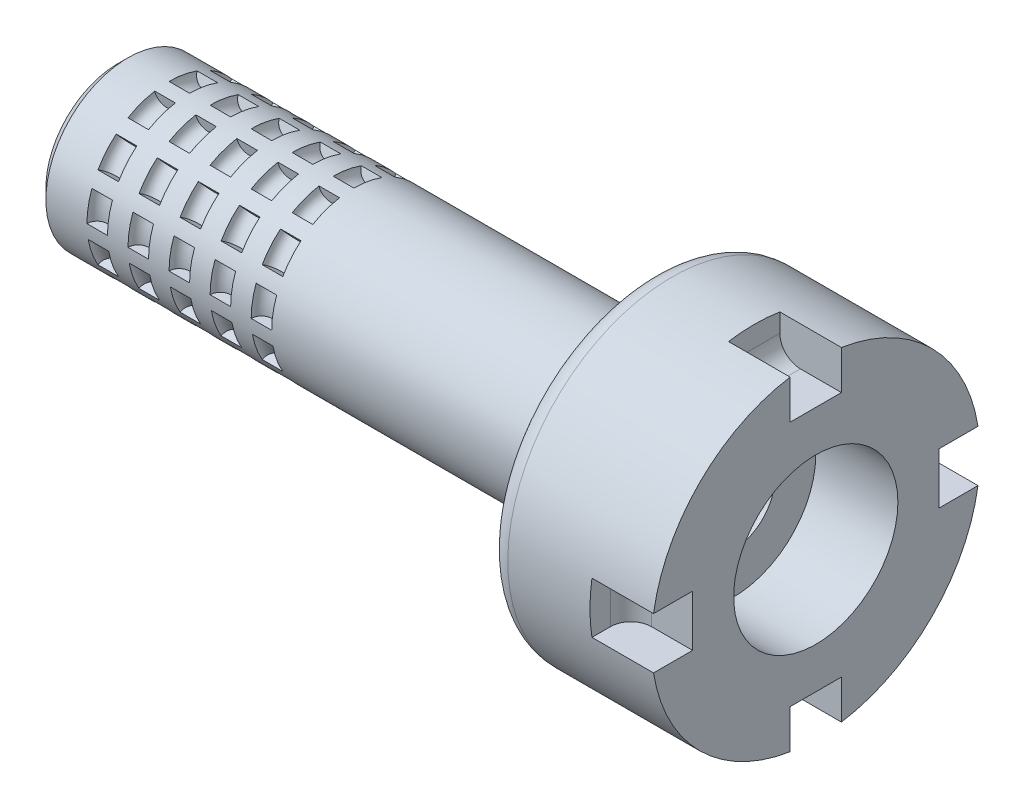
from build123d import *

# Parameters (mm, degrees)
WYTNIJ_WYCI_GNI_CIE1_START      = -40
SZKIC3_R                        = 40
WYTNIJ_WYCI_GNI_CIE1_DEPTH      = 40
SZKIC4_W                        = 25
SZKIC4_H                        = 30
WYTNIJ_WYCI_GNI_CIE2_DEPTH      = 30
ZAOKR_GLENIE1_R                 = 10
SZYK_KO_OWY2_COUNT              = 4
ZAOKR_GLENIE1_OF_SZYK_KO_OWY2_R = 10
ZAOKR_GLENIE2_R                 = 10
SFAZOWANIE1_SIZE                = 5
SZKIC6_W                        = 15
SZKIC6_H                        = 5
ZAOKR_GLENIE3_R                 = 2.5
SZKIC7_R                        = 5
WYCI_CIE_OBR_T3_ANGLE           = 20
SZYK_KO_OWY3_COUNT              = 12
SZYK_LINIOWY1_COUNT             = 5
SZYK_LINIOWY1_PITCH             = 20
SZYK_LINIOWY1_COPY_1_SKETCH_R   = 5
SZYK_LINIOWY1_COPY_1_ANGLE      = 20
SZYK_LINIOWY1_COPY_2_SKETCH_R   = 5
SZYK_LINIOWY1_COPY_2_ANGLE      = 20
SZYK_LINIOWY1_COPY_3_SKETCH_R   = 5
SZYK_LINIOWY1_COPY_3_ANGLE      = 20
SZYK_LINIOWY1_COPY_4_SKETCH_R   = 5
SZYK_LINIOWY1_COPY_4_ANGLE      = 20
SZYK_LINIOWY1_COPY_5_SKETCH_R   = 5
SZYK_LINIOWY1_COPY_5_ANGLE      = 20
SZYK_LINIOWY1_COPY_6_SKETCH_R   = 5
SZYK_LINIOWY1_COPY_6_ANGLE      = 20
SZYK_LINIOWY1_COPY_7_SKETCH_R   = 5
SZYK_LINIOWY1_COPY_7_ANGLE      = 20
SZYK_LINIOWY1_COPY_8_SKETCH_R   = 5
SZYK_LINIOWY1_COPY_8_ANGLE      = 20
SZYK_LINIOWY1_COPY_9_SKETCH_R   = 5
SZYK_LINIOWY1_COPY_9_ANGLE      = 20
SZYK_LINIOWY1_COPY_10_SKETCH_R  = 5
SZYK_LINIOWY1_COPY_10_ANGLE     = 20
SZYK_LINIOWY1_COPY_11_SKETCH_R  = 5
SZYK_LINIOWY1_COPY_11_ANGLE     = 20
SZYK_LINIOWY1_COPY_12_SKETCH_R  = 5
SZYK_LINIOWY1_COPY_12_ANGLE     = 20
SZYK_LINIOWY1_COPY_13_SKETCH_R  = 5
SZYK_LINIOWY1_COPY_13_ANGLE     = 20
SZYK_LINIOWY1_COPY_14_SKETCH_R  = 5
SZYK_LINIOWY1_COPY_14_ANGLE     = 20
SZYK_LINIOWY1_COPY_15_SKETCH_R  = 5
SZYK_LINIOWY1_COPY_15_ANGLE     = 20
SZYK_LINIOWY1_COPY_16_SKETCH_R  = 5
SZYK_LINIOWY1_COPY_16_ANGLE     = 20
SZYK_LINIOWY1_COPY_17_SKETCH_R  = 5
SZYK_LINIOWY1_COPY_17_ANGLE     = 20
SZYK_LINIOWY1_COPY_18_SKETCH_R  = 5
SZYK_LINIOWY1_COPY_18_ANGLE     = 20
SZYK_LINIOWY1_COPY_19_SKETCH_R  = 5
SZYK_LINIOWY1_COPY_19_ANGLE     = 20
SZYK_LINIOWY1_COPY_20_SKETCH_R  = 5
SZYK_LINIOWY1_COPY_20_ANGLE     = 20
SZYK_LINIOWY1_COPY_21_SKETCH_R  = 5
SZYK_LINIOWY1_COPY_21_ANGLE     = 20
SZYK_LINIOWY1_COPY_22_SKETCH_R  = 5
SZYK_LINIOWY1_COPY_22_ANGLE     = 20
SZYK_LINIOWY1_COPY_23_SKETCH_R  = 5
SZYK_LINIOWY1_COPY_23_ANGLE     = 20
SZYK_LINIOWY1_COPY_24_SKETCH_R  = 5
SZYK_LINIOWY1_COPY_24_ANGLE     = 20
SZYK_LINIOWY1_COPY_25_SKETCH_R  = 5
SZYK_LINIOWY1_COPY_25_ANGLE     = 20
SZYK_LINIOWY1_COPY_26_SKETCH_R  = 5
SZYK_LINIOWY1_COPY_26_ANGLE     = 20
SZYK_LINIOWY1_COPY_27_SKETCH_R  = 5
SZYK_LINIOWY1_COPY_27_ANGLE     = 20
SZYK_LINIOWY1_COPY_28_SKETCH_R  = 5
SZYK_LINIOWY1_COPY_28_ANGLE     = 20
SZYK_LINIOWY1_COPY_29_SKETCH_R  = 5
SZYK_LINIOWY1_COPY_29_ANGLE     = 20
SZYK_LINIOWY1_COPY_30_SKETCH_R  = 5
SZYK_LINIOWY1_COPY_30_ANGLE     = 20
SZYK_LINIOWY1_COPY_31_SKETCH_R  = 5
SZYK_LINIOWY1_COPY_31_ANGLE     = 20
SZYK_LINIOWY1_COPY_32_SKETCH_R  = 5
SZYK_LINIOWY1_COPY_32_ANGLE     = 20
SZYK_LINIOWY1_COPY_33_SKETCH_R  = 5
SZYK_LINIOWY1_COPY_33_ANGLE     = 20
SZYK_LINIOWY1_COPY_34_SKETCH_R  = 5
SZYK_LINIOWY1_COPY_34_ANGLE     = 20
SZYK_LINIOWY1_COPY_35_SKETCH_R  = 5
SZYK_LINIOWY1_COPY_35_ANGLE     = 20
SZYK_LINIOWY1_COPY_36_SKETCH_R  = 5
SZYK_LINIOWY1_COPY_36_ANGLE     = 20
SZYK_LINIOWY1_COPY_37_SKETCH_R  = 5
SZYK_LINIOWY1_COPY_37_ANGLE     = 20
SZYK_LINIOWY1_COPY_38_SKETCH_R  = 5
SZYK_LINIOWY1_COPY_38_ANGLE     = 20
SZYK_LINIOWY1_COPY_39_SKETCH_R  = 5
SZYK_LINIOWY1_COPY_39_ANGLE     = 20
SZYK_LINIOWY1_COPY_40_SKETCH_R  = 5
SZYK_LINIOWY1_COPY_40_ANGLE     = 20
SZYK_LINIOWY1_COPY_41_SKETCH_R  = 5
SZYK_LINIOWY1_COPY_41_ANGLE     = 20
SZYK_LINIOWY1_COPY_42_SKETCH_R  = 5
SZYK_LINIOWY1_COPY_42_ANGLE     = 20
SZYK_LINIOWY1_COPY_43_SKETCH_R  = 5
SZYK_LINIOWY1_COPY_43_ANGLE     = 20
SZYK_LINIOWY1_COPY_44_SKETCH_R  = 5
SZYK_LINIOWY1_COPY_44_ANGLE     = 20


with BuildPart() as part:
    # Szkic1 → Obrót1 (revolve)
    with BuildSketch(Plane.XY, mode=Mode.PRIVATE) as obr_t1_sk:
        Polygon((0, 20), (340, 20), (340, 80), (260, 80), (260, 40), (0, 40), align=None)
    revolve(obr_t1_sk.sketch.rotate(Axis((0, 0, 0), (1, 0, 0)), 90), axis=Axis((0, 0, 0), (1, 0, 0)))

    # Szkic3 → Wytnij-wyciągnięcie1 (cut)
    with BuildSketch(Plane(origin=(340, 0, 0), x_dir=(0, 0, -1), z_dir=(1, 0, 0)).offset(WYTNIJ_WYCI_GNI_CIE1_START)):
        with Locations(Location((0, 0, 0), (0, 0, 180))):
            Circle(SZKIC3_R)
    extrude(amount=WYTNIJ_WYCI_GNI_CIE1_DEPTH, mode=Mode.SUBTRACT)

    # Szkic4 → Wytnij-wyciągnięcie2 (cut)
    with BuildSketch(Plane(origin=(340, 0, 0), x_dir=(0, 0, -1), z_dir=(1, 0, 0))):
        with Locations((0, 75)):
            Rectangle(SZKIC4_W, SZKIC4_H)
    wytnij_wyci_gni_cie2 = extrude(amount=-WYTNIJ_WYCI_GNI_CIE2_DEPTH, mode=Mode.SUBTRACT)

    # Zaokrąglenie1
    zaokr_glenie1_edges = [part.edges().sort_by_distance(p)[0] for p in [
        (310, 60, 0),
    ]]
    fillet(zaokr_glenie1_edges, radius=ZAOKR_GLENIE1_R)

    # Szyk kołowy2: Wytnij-wyciągnięcie2 ×4 about axis
    szyk_ko_owy2_axis = Axis((0, 0, 0), (1, 0, 0))
    for i in range(1, SZYK_KO_OWY2_COUNT):
        add(wytnij_wyci_gni_cie2.rotate(szyk_ko_owy2_axis, i * 360 / SZYK_KO_OWY2_COUNT), mode=Mode.SUBTRACT)

    # Zaokrąglenie1 of Szyk kołowy2
    zaokr_glenie1_of_szyk_ko_owy2_edges = [part.edges().sort_by_distance(p)[0] for p in [
        (310, 0, 60),
        (310, -60, 0),
        (310, 0, -60),
    ]]
    fillet(zaokr_glenie1_of_szyk_ko_owy2_edges, radius=ZAOKR_GLENIE1_OF_SZYK_KO_OWY2_R)

    # Zaokrąglenie2
    zaokr_glenie2_edges = [part.edges().sort_by_distance(p)[0] for p in [
        (260, 0, -40),
        (260, 0, -80),
    ]]
    fillet(zaokr_glenie2_edges, radius=ZAOKR_GLENIE2_R)

    # Sfazowanie1
    sfazowanie1_edges = [part.edges().sort_by_distance(p)[0] for p in [
        (0, 0, -40),
    ]]
    chamfer(sfazowanie1_edges, length=SFAZOWANIE1_SIZE)

    # Szkic6 → Wycięcie-obrót1 (revolve, cut)
    with BuildSketch(Plane.XY, mode=Mode.PRIVATE) as wyci_cie_obr_t1_sk:
        with Locations((0.5, 27.5)):
            Rectangle(SZKIC6_W, SZKIC6_H)
    revolve(wyci_cie_obr_t1_sk.sketch.rotate(Axis((0, 0, 0), (-1, 0, 0)), 90), axis=Axis((0, 0, 0), (-1, 0, 0)), mode=Mode.SUBTRACT)

    # Zaokrąglenie3
    zaokr_glenie3_edges = [part.edges().sort_by_distance(p)[0] for p in [
        (8, 0, 25),
        (0, 0, 25),
        (8, 0, 30),
    ]]
    fillet(zaokr_glenie3_edges, radius=ZAOKR_GLENIE3_R - 0.0001)  # a hair under: the kernel refuses the full size

    # Szkic7 → Wycięcie-obrót3 (revolve, cut)
    with BuildSketch(Plane.XY):
        with Locations((30, 40)):
            Circle(SZKIC7_R)
    wyci_cie_obr_t3 = revolve(axis=Axis((0, 0, 0), (-1, 0, 0)), revolution_arc=WYCI_CIE_OBR_T3_ANGLE, mode=Mode.SUBTRACT)

    # Szyk kołowy3: Wycięcie-obrót3 ×12 about axis
    szyk_ko_owy3_axis = Axis((0, 0, 0), (1, 0, 0))
    for i in range(1, SZYK_KO_OWY3_COUNT):
        add(wyci_cie_obr_t3.rotate(szyk_ko_owy3_axis, i * 360 / SZYK_KO_OWY3_COUNT), mode=Mode.SUBTRACT)

    # Szyk liniowy1: Wycięcie-obrót3 ×5
    with Locations(*[(i * SZYK_LINIOWY1_PITCH, 0, 0) for i in range(1, SZYK_LINIOWY1_COUNT)]):
        add(wyci_cie_obr_t3, mode=Mode.SUBTRACT)

    # Szyk liniowy1 copy 1 sketch → Szyk liniowy1 copy 1 (revolve, cut)
    with BuildSketch(Plane(origin=(20, 0, 0), x_dir=(1, 0, 0), z_dir=(0, -0.49999999999999994, 0.8660254037844387))):
        with Locations((30, 40)):
            Circle(SZYK_LINIOWY1_COPY_1_SKETCH_R)
    revolve(axis=Axis((20, 0, 0), (-1, 0, 0)), revolution_arc=SZYK_LINIOWY1_COPY_1_ANGLE, mode=Mode.SUBTRACT)

    # Szyk liniowy1 copy 2 sketch → Szyk liniowy1 copy 2 (revolve, cut)
    with BuildSketch(Plane(origin=(40, 0, 0), x_dir=(1, 0, 0), z_dir=(0, -0.49999999999999994, 0.8660254037844387))):
        with Locations((30, 40)):
            Circle(SZYK_LINIOWY1_COPY_2_SKETCH_R)
    revolve(axis=Axis((40, 0, 0), (-1, 0, 0)), revolution_arc=SZYK_LINIOWY1_COPY_2_ANGLE, mode=Mode.SUBTRACT)

    # Szyk liniowy1 copy 3 sketch → Szyk liniowy1 copy 3 (revolve, cut)
    with BuildSketch(Plane(origin=(60, 0, 0), x_dir=(1, 0, 0), z_dir=(0, -0.49999999999999994, 0.8660254037844387))):
        with Locations((30, 40)):
            Circle(SZYK_LINIOWY1_COPY_3_SKETCH_R)
    revolve(axis=Axis((60, 0, 0), (-1, 0, 0)), revolution_arc=SZYK_LINIOWY1_COPY_3_ANGLE, mode=Mode.SUBTRACT)

    # Szyk liniowy1 copy 4 sketch → Szyk liniowy1 copy 4 (revolve, cut)
    with BuildSketch(Plane(origin=(80, 0, 0), x_dir=(1, 0, 0), z_dir=(0, -0.49999999999999994, 0.8660254037844387))):
        with Locations((30, 40)):
            Circle(SZYK_LINIOWY1_COPY_4_SKETCH_R)
    revolve(axis=Axis((80, 0, 0), (-1, 0, 0)), revolution_arc=SZYK_LINIOWY1_COPY_4_ANGLE, mode=Mode.SUBTRACT)

    # Szyk liniowy1 copy 5 sketch → Szyk liniowy1 copy 5 (revolve, cut)
    with BuildSketch(Plane(origin=(20, 0, 0), x_dir=(1, 0, 0), z_dir=(0, -0.8660254037844386, 0.5000000000000001))):
        with Locations((30, 40)):
            Circle(SZYK_LINIOWY1_COPY_5_SKETCH_R)
    revolve(axis=Axis((20, 0, 0), (-1, 0, 0)), revolution_arc=SZYK_LINIOWY1_COPY_5_ANGLE, mode=Mode.SUBTRACT)

    # Szyk liniowy1 copy 6 sketch → Szyk liniowy1 copy 6 (revolve, cut)
    with BuildSketch(Plane(origin=(40, 0, 0), x_dir=(1, 0, 0), z_dir=(0, -0.8660254037844386, 0.5000000000000001))):
        with Locations((30, 40)):
            Circle(SZYK_LINIOWY1_COPY_6_SKETCH_R)
    revolve(axis=Axis((40, 0, 0), (-1, 0, 0)), revolution_arc=SZYK_LINIOWY1_COPY_6_ANGLE, mode=Mode.SUBTRACT)

    # Szyk liniowy1 copy 7 sketch → Szyk liniowy1 copy 7 (revolve, cut)
    with BuildSketch(Plane(origin=(60, 0, 0), x_dir=(1, 0, 0), z_dir=(0, -0.8660254037844386, 0.5000000000000001))):
        with Locations((30, 40)):
            Circle(SZYK_LINIOWY1_COPY_7_SKETCH_R)
    revolve(axis=Axis((60, 0, 0), (-1, 0, 0)), revolution_arc=SZYK_LINIOWY1_COPY_7_ANGLE, mode=Mode.SUBTRACT)

    # Szyk liniowy1 copy 8 sketch → Szyk liniowy1 copy 8 (revolve, cut)
    with BuildSketch(Plane(origin=(80, 0, 0), x_dir=(1, 0, 0), z_dir=(0, -0.8660254037844386, 0.5000000000000001))):
        with Locations((30, 40)):
            Circle(SZYK_LINIOWY1_COPY_8_SKETCH_R)
    revolve(axis=Axis((80, 0, 0), (-1, 0, 0)), revolution_arc=SZYK_LINIOWY1_COPY_8_ANGLE, mode=Mode.SUBTRACT)

    # Szyk liniowy1 copy 9 sketch → Szyk liniowy1 copy 9 (revolve, cut)
    with BuildSketch(Plane(origin=(20, 0, 0), x_dir=(1, 0, 0), z_dir=(0, -1, 0))):
        with Locations((30, 40)):
            Circle(SZYK_LINIOWY1_COPY_9_SKETCH_R)
    revolve(axis=Axis((20, 0, 0), (-1, 0, 0)), revolution_arc=SZYK_LINIOWY1_COPY_9_ANGLE, mode=Mode.SUBTRACT)

    # Szyk liniowy1 copy 10 sketch → Szyk liniowy1 copy 10 (revolve, cut)
    with BuildSketch(Plane(origin=(40, 0, 0), x_dir=(1, 0, 0), z_dir=(0, -1, 0))):
        with Locations((30, 40)):
            Circle(SZYK_LINIOWY1_COPY_10_SKETCH_R)
    revolve(axis=Axis((40, 0, 0), (-1, 0, 0)), revolution_arc=SZYK_LINIOWY1_COPY_10_ANGLE, mode=Mode.SUBTRACT)

    # Szyk liniowy1 copy 11 sketch → Szyk liniowy1 copy 11 (revolve, cut)
    with BuildSketch(Plane(origin=(60, 0, 0), x_dir=(1, 0, 0), z_dir=(0, -1, 0))):
        with Locations((30, 40)):
            Circle(SZYK_LINIOWY1_COPY_11_SKETCH_R)
    revolve(axis=Axis((60, 0, 0), (-1, 0, 0)), revolution_arc=SZYK_LINIOWY1_COPY_11_ANGLE, mode=Mode.SUBTRACT)

    # Szyk liniowy1 copy 12 sketch → Szyk liniowy1 copy 12 (revolve, cut)
    with BuildSketch(Plane(origin=(80, 0, 0), x_dir=(1, 0, 0), z_dir=(0, -1, 0))):
        with Locations((30, 40)):
            Circle(SZYK_LINIOWY1_COPY_12_SKETCH_R)
    revolve(axis=Axis((80, 0, 0), (-1, 0, 0)), revolution_arc=SZYK_LINIOWY1_COPY_12_ANGLE, mode=Mode.SUBTRACT)

    # Szyk liniowy1 copy 13 sketch → Szyk liniowy1 copy 13 (revolve, cut)
    with BuildSketch(Plane(origin=(20, 0, 0), x_dir=(1, 0, 0), z_dir=(0, -0.8660254037844387, -0.4999999999999998))):
        with Locations((30, 40)):
            Circle(SZYK_LINIOWY1_COPY_13_SKETCH_R)
    revolve(axis=Axis((20, 0, 0), (-1, 0, 0)), revolution_arc=SZYK_LINIOWY1_COPY_13_ANGLE, mode=Mode.SUBTRACT)

    # Szyk liniowy1 copy 14 sketch → Szyk liniowy1 copy 14 (revolve, cut)
    with BuildSketch(Plane(origin=(40, 0, 0), x_dir=(1, 0, 0), z_dir=(0, -0.8660254037844387, -0.4999999999999998))):
        with Locations((30, 40)):
            Circle(SZYK_LINIOWY1_COPY_14_SKETCH_R)
    revolve(axis=Axis((40, 0, 0), (-1, 0, 0)), revolution_arc=SZYK_LINIOWY1_COPY_14_ANGLE, mode=Mode.SUBTRACT)

    # Szyk liniowy1 copy 15 sketch → Szyk liniowy1 copy 15 (revolve, cut)
    with BuildSketch(Plane(origin=(60, 0, 0), x_dir=(1, 0, 0), z_dir=(0, -0.8660254037844387, -0.4999999999999998))):
        with Locations((30, 40)):
            Circle(SZYK_LINIOWY1_COPY_15_SKETCH_R)
    revolve(axis=Axis((60, 0, 0), (-1, 0, 0)), revolution_arc=SZYK_LINIOWY1_COPY_15_ANGLE, mode=Mode.SUBTRACT)

    # Szyk liniowy1 copy 16 sketch → Szyk liniowy1 copy 16 (revolve, cut)
    with BuildSketch(Plane(origin=(80, 0, 0), x_dir=(1, 0, 0), z_dir=(0, -0.8660254037844387, -0.4999999999999998))):
        with Locations((30, 40)):
            Circle(SZYK_LINIOWY1_COPY_16_SKETCH_R)
    revolve(axis=Axis((80, 0, 0), (-1, 0, 0)), revolution_arc=SZYK_LINIOWY1_COPY_16_ANGLE, mode=Mode.SUBTRACT)

    # Szyk liniowy1 copy 17 sketch → Szyk liniowy1 copy 17 (revolve, cut)
    with BuildSketch(Plane(origin=(20, 0, 0), x_dir=(1, 0, 0), z_dir=(0, -0.49999999999999994, -0.8660254037844387))):
        with Locations((30, 40)):
            Circle(SZYK_LINIOWY1_COPY_17_SKETCH_R)
    revolve(axis=Axis((20, 0, 0), (-1, 0, 0)), revolution_arc=SZYK_LINIOWY1_COPY_17_ANGLE, mode=Mode.SUBTRACT)

    # Szyk liniowy1 copy 18 sketch → Szyk liniowy1 copy 18 (revolve, cut)
    with BuildSketch(Plane(origin=(40, 0, 0), x_dir=(1, 0, 0), z_dir=(0, -0.49999999999999994, -0.8660254037844387))):
        with Locations((30, 40)):
            Circle(SZYK_LINIOWY1_COPY_18_SKETCH_R)
    revolve(axis=Axis((40, 0, 0), (-1, 0, 0)), revolution_arc=SZYK_LINIOWY1_COPY_18_ANGLE, mode=Mode.SUBTRACT)

    # Szyk liniowy1 copy 19 sketch → Szyk liniowy1 copy 19 (revolve, cut)
    with BuildSketch(Plane(origin=(60, 0, 0), x_dir=(1, 0, 0), z_dir=(0, -0.49999999999999994, -0.8660254037844387))):
        with Locations((30, 40)):
            Circle(SZYK_LINIOWY1_COPY_19_SKETCH_R)
    revolve(axis=Axis((60, 0, 0), (-1, 0, 0)), revolution_arc=SZYK_LINIOWY1_COPY_19_ANGLE, mode=Mode.SUBTRACT)

    # Szyk liniowy1 copy 20 sketch → Szyk liniowy1 copy 20 (revolve, cut)
    with BuildSketch(Plane(origin=(80, 0, 0), x_dir=(1, 0, 0), z_dir=(0, -0.49999999999999994, -0.8660254037844387))):
        with Locations((30, 40)):
            Circle(SZYK_LINIOWY1_COPY_20_SKETCH_R)
    revolve(axis=Axis((80, 0, 0), (-1, 0, 0)), revolution_arc=SZYK_LINIOWY1_COPY_20_ANGLE, mode=Mode.SUBTRACT)

    # Szyk liniowy1 copy 21 sketch → Szyk liniowy1 copy 21 (revolve, cut)
    with BuildSketch(Plane(origin=(20, 0, 0), x_dir=(1, 0, 0), z_dir=(0, 0, -1))):
        with Locations((30, 40)):
            Circle(SZYK_LINIOWY1_COPY_21_SKETCH_R)
    revolve(axis=Axis((20, 0, 0), (-1, 0, 0)), revolution_arc=SZYK_LINIOWY1_COPY_21_ANGLE, mode=Mode.SUBTRACT)

    # Szyk liniowy1 copy 22 sketch → Szyk liniowy1 copy 22 (revolve, cut)
    with BuildSketch(Plane(origin=(40, 0, 0), x_dir=(1, 0, 0), z_dir=(0, 0, -1))):
        with Locations((30, 40)):
            Circle(SZYK_LINIOWY1_COPY_22_SKETCH_R)
    revolve(axis=Axis((40, 0, 0), (-1, 0, 0)), revolution_arc=SZYK_LINIOWY1_COPY_22_ANGLE, mode=Mode.SUBTRACT)

    # Szyk liniowy1 copy 23 sketch → Szyk liniowy1 copy 23 (revolve, cut)
    with BuildSketch(Plane(origin=(60, 0, 0), x_dir=(1, 0, 0), z_dir=(0, 0, -1))):
        with Locations((30, 40)):
            Circle(SZYK_LINIOWY1_COPY_23_SKETCH_R)
    revolve(axis=Axis((60, 0, 0), (-1, 0, 0)), revolution_arc=SZYK_LINIOWY1_COPY_23_ANGLE, mode=Mode.SUBTRACT)

    # Szyk liniowy1 copy 24 sketch → Szyk liniowy1 copy 24 (revolve, cut)
    with BuildSketch(Plane(origin=(80, 0, 0), x_dir=(1, 0, 0), z_dir=(0, 0, -1))):
        with Locations((30, 40)):
            Circle(SZYK_LINIOWY1_COPY_24_SKETCH_R)
    revolve(axis=Axis((80, 0, 0), (-1, 0, 0)), revolution_arc=SZYK_LINIOWY1_COPY_24_ANGLE, mode=Mode.SUBTRACT)

    # Szyk liniowy1 copy 25 sketch → Szyk liniowy1 copy 25 (revolve, cut)
    with BuildSketch(Plane(origin=(20, 0, 0), x_dir=(1, 0, 0), z_dir=(0, 0.5000000000000001, -0.8660254037844386))):
        with Locations((30, 40)):
            Circle(SZYK_LINIOWY1_COPY_25_SKETCH_R)
    revolve(axis=Axis((20, 0, 0), (-1, 0, 0)), revolution_arc=SZYK_LINIOWY1_COPY_25_ANGLE, mode=Mode.SUBTRACT)

    # Szyk liniowy1 copy 26 sketch → Szyk liniowy1 copy 26 (revolve, cut)
    with BuildSketch(Plane(origin=(40, 0, 0), x_dir=(1, 0, 0), z_dir=(0, 0.5000000000000001, -0.8660254037844386))):
        with Locations((30, 40)):
            Circle(SZYK_LINIOWY1_COPY_26_SKETCH_R)
    revolve(axis=Axis((40, 0, 0), (-1, 0, 0)), revolution_arc=SZYK_LINIOWY1_COPY_26_ANGLE, mode=Mode.SUBTRACT)

    # Szyk liniowy1 copy 27 sketch → Szyk liniowy1 copy 27 (revolve, cut)
    with BuildSketch(Plane(origin=(60, 0, 0), x_dir=(1, 0, 0), z_dir=(0, 0.5000000000000001, -0.8660254037844386))):
        with Locations((30, 40)):
            Circle(SZYK_LINIOWY1_COPY_27_SKETCH_R)
    revolve(axis=Axis((60, 0, 0), (-1, 0, 0)), revolution_arc=SZYK_LINIOWY1_COPY_27_ANGLE, mode=Mode.SUBTRACT)

    # Szyk liniowy1 copy 28 sketch → Szyk liniowy1 copy 28 (revolve, cut)
    with BuildSketch(Plane(origin=(80, 0, 0), x_dir=(1, 0, 0), z_dir=(0, 0.5000000000000001, -0.8660254037844386))):
        with Locations((30, 40)):
            Circle(SZYK_LINIOWY1_COPY_28_SKETCH_R)
    revolve(axis=Axis((80, 0, 0), (-1, 0, 0)), revolution_arc=SZYK_LINIOWY1_COPY_28_ANGLE, mode=Mode.SUBTRACT)

    # Szyk liniowy1 copy 29 sketch → Szyk liniowy1 copy 29 (revolve, cut)
    with BuildSketch(Plane(origin=(20, 0, 0), x_dir=(1, 0, 0), z_dir=(0, 0.8660254037844384, -0.5000000000000004))):
        with Locations((30, 40)):
            Circle(SZYK_LINIOWY1_COPY_29_SKETCH_R)
    revolve(axis=Axis((20, 0, 0), (-1, 0, 0)), revolution_arc=SZYK_LINIOWY1_COPY_29_ANGLE, mode=Mode.SUBTRACT)

    # Szyk liniowy1 copy 30 sketch → Szyk liniowy1 copy 30 (revolve, cut)
    with BuildSketch(Plane(origin=(40, 0, 0), x_dir=(1, 0, 0), z_dir=(0, 0.8660254037844384, -0.5000000000000004))):
        with Locations((30, 40)):
            Circle(SZYK_LINIOWY1_COPY_30_SKETCH_R)
    revolve(axis=Axis((40, 0, 0), (-1, 0, 0)), revolution_arc=SZYK_LINIOWY1_COPY_30_ANGLE, mode=Mode.SUBTRACT)

    # Szyk liniowy1 copy 31 sketch → Szyk liniowy1 copy 31 (revolve, cut)
    with BuildSketch(Plane(origin=(60, 0, 0), x_dir=(1, 0, 0), z_dir=(0, 0.8660254037844384, -0.5000000000000004))):
        with Locations((30, 40)):
            Circle(SZYK_LINIOWY1_COPY_31_SKETCH_R)
    revolve(axis=Axis((60, 0, 0), (-1, 0, 0)), revolution_arc=SZYK_LINIOWY1_COPY_31_ANGLE, mode=Mode.SUBTRACT)

    # Szyk liniowy1 copy 32 sketch → Szyk liniowy1 copy 32 (revolve, cut)
    with BuildSketch(Plane(origin=(80, 0, 0), x_dir=(1, 0, 0), z_dir=(0, 0.8660254037844384, -0.5000000000000004))):
        with Locations((30, 40)):
            Circle(SZYK_LINIOWY1_COPY_32_SKETCH_R)
    revolve(axis=Axis((80, 0, 0), (-1, 0, 0)), revolution_arc=SZYK_LINIOWY1_COPY_32_ANGLE, mode=Mode.SUBTRACT)

    # Szyk liniowy1 copy 33 sketch → Szyk liniowy1 copy 33 (revolve, cut)
    with BuildSketch(Plane(origin=(20, 0, 0), x_dir=(1, 0, 0), z_dir=(0, 1, 0))):
        with Locations((30, 40)):
            Circle(SZYK_LINIOWY1_COPY_33_SKETCH_R)
    revolve(axis=Axis((20, 0, 0), (-1, 0, 0)), revolution_arc=SZYK_LINIOWY1_COPY_33_ANGLE, mode=Mode.SUBTRACT)

    # Szyk liniowy1 copy 34 sketch → Szyk liniowy1 copy 34 (revolve, cut)
    with BuildSketch(Plane(origin=(40, 0, 0), x_dir=(1, 0, 0), z_dir=(0, 1, 0))):
        with Locations((30, 40)):
            Circle(SZYK_LINIOWY1_COPY_34_SKETCH_R)
    revolve(axis=Axis((40, 0, 0), (-1, 0, 0)), revolution_arc=SZYK_LINIOWY1_COPY_34_ANGLE, mode=Mode.SUBTRACT)

    # Szyk liniowy1 copy 35 sketch → Szyk liniowy1 copy 35 (revolve, cut)
    with BuildSketch(Plane(origin=(60, 0, 0), x_dir=(1, 0, 0), z_dir=(0, 1, 0))):
        with Locations((30, 40)):
            Circle(SZYK_LINIOWY1_COPY_35_SKETCH_R)
    revolve(axis=Axis((60, 0, 0), (-1, 0, 0)), revolution_arc=SZYK_LINIOWY1_COPY_35_ANGLE, mode=Mode.SUBTRACT)

    # Szyk liniowy1 copy 36 sketch → Szyk liniowy1 copy 36 (revolve, cut)
    with BuildSketch(Plane(origin=(80, 0, 0), x_dir=(1, 0, 0), z_dir=(0, 1, 0))):
        with Locations((30, 40)):
            Circle(SZYK_LINIOWY1_COPY_36_SKETCH_R)
    revolve(axis=Axis((80, 0, 0), (-1, 0, 0)), revolution_arc=SZYK_LINIOWY1_COPY_36_ANGLE, mode=Mode.SUBTRACT)

    # Szyk liniowy1 copy 37 sketch → Szyk liniowy1 copy 37 (revolve, cut)
    with BuildSketch(Plane(origin=(20, 0, 0), x_dir=(1, 0, 0), z_dir=(0, 0.8660254037844386, 0.5000000000000001))):
        with Locations((30, 40)):
            Circle(SZYK_LINIOWY1_COPY_37_SKETCH_R)
    revolve(axis=Axis((20, 0, 0), (-1, 0, 0)), revolution_arc=SZYK_LINIOWY1_COPY_37_ANGLE, mode=Mode.SUBTRACT)

    # Szyk liniowy1 copy 38 sketch → Szyk liniowy1 copy 38 (revolve, cut)
    with BuildSketch(Plane(origin=(40, 0, 0), x_dir=(1, 0, 0), z_dir=(0, 0.8660254037844386, 0.5000000000000001))):
        with Locations((30, 40)):
            Circle(SZYK_LINIOWY1_COPY_38_SKETCH_R)
    revolve(axis=Axis((40, 0, 0), (-1, 0, 0)), revolution_arc=SZYK_LINIOWY1_COPY_38_ANGLE, mode=Mode.SUBTRACT)

    # Szyk liniowy1 copy 39 sketch → Szyk liniowy1 copy 39 (revolve, cut)
    with BuildSketch(Plane(origin=(60, 0, 0), x_dir=(1, 0, 0), z_dir=(0, 0.8660254037844386, 0.5000000000000001))):
        with Locations((30, 40)):
            Circle(SZYK_LINIOWY1_COPY_39_SKETCH_R)
    revolve(axis=Axis((60, 0, 0), (-1, 0, 0)), revolution_arc=SZYK_LINIOWY1_COPY_39_ANGLE, mode=Mode.SUBTRACT)

    # Szyk liniowy1 copy 40 sketch → Szyk liniowy1 copy 40 (revolve, cut)
    with BuildSketch(Plane(origin=(80, 0, 0), x_dir=(1, 0, 0), z_dir=(0, 0.8660254037844386, 0.5000000000000001))):
        with Locations((30, 40)):
            Circle(SZYK_LINIOWY1_COPY_40_SKETCH_R)
    revolve(axis=Axis((80, 0, 0), (-1, 0, 0)), revolution_arc=SZYK_LINIOWY1_COPY_40_ANGLE, mode=Mode.SUBTRACT)

    # Szyk liniowy1 copy 41 sketch → Szyk liniowy1 copy 41 (revolve, cut)
    with BuildSketch(Plane(origin=(20, 0, 0), x_dir=(1, 0, 0), z_dir=(0, 0.5000000000000004, 0.8660254037844384))):
        with Locations((30, 40)):
            Circle(SZYK_LINIOWY1_COPY_41_SKETCH_R)
    revolve(axis=Axis((20, 0, 0), (-1, 0, 0)), revolution_arc=SZYK_LINIOWY1_COPY_41_ANGLE, mode=Mode.SUBTRACT)

    # Szyk liniowy1 copy 42 sketch → Szyk liniowy1 copy 42 (revolve, cut)
    with BuildSketch(Plane(origin=(40, 0, 0), x_dir=(1, 0, 0), z_dir=(0, 0.5000000000000004, 0.8660254037844384))):
        with Locations((30, 40)):
            Circle(SZYK_LINIOWY1_COPY_42_SKETCH_R)
    revolve(axis=Axis((40, 0, 0), (-1, 0, 0)), revolution_arc=SZYK_LINIOWY1_COPY_42_ANGLE, mode=Mode.SUBTRACT)

    # Szyk liniowy1 copy 43 sketch → Szyk liniowy1 copy 43 (revolve, cut)
    with BuildSketch(Plane(origin=(60, 0, 0), x_dir=(1, 0, 0), z_dir=(0, 0.5000000000000004, 0.8660254037844384))):
        with Locations((30, 40)):
            Circle(SZYK_LINIOWY1_COPY_43_SKETCH_R)
    revolve(axis=Axis((60, 0, 0), (-1, 0, 0)), revolution_arc=SZYK_LINIOWY1_COPY_43_ANGLE, mode=Mode.SUBTRACT)

    # Szyk liniowy1 copy 44 sketch → Szyk liniowy1 copy 44 (revolve, cut)
    with BuildSketch(Plane(origin=(80, 0, 0), x_dir=(1, 0, 0), z_dir=(0, 0.5000000000000004, 0.8660254037844384))):
        with Locations((30, 40)):
            Circle(SZYK_LINIOWY1_COPY_44_SKETCH_R)
    revolve(axis=Axis((80, 0, 0), (-1, 0, 0)), revolution_arc=SZYK_LINIOWY1_COPY_44_ANGLE, mode=Mode.SUBTRACT)


solid = part.part
